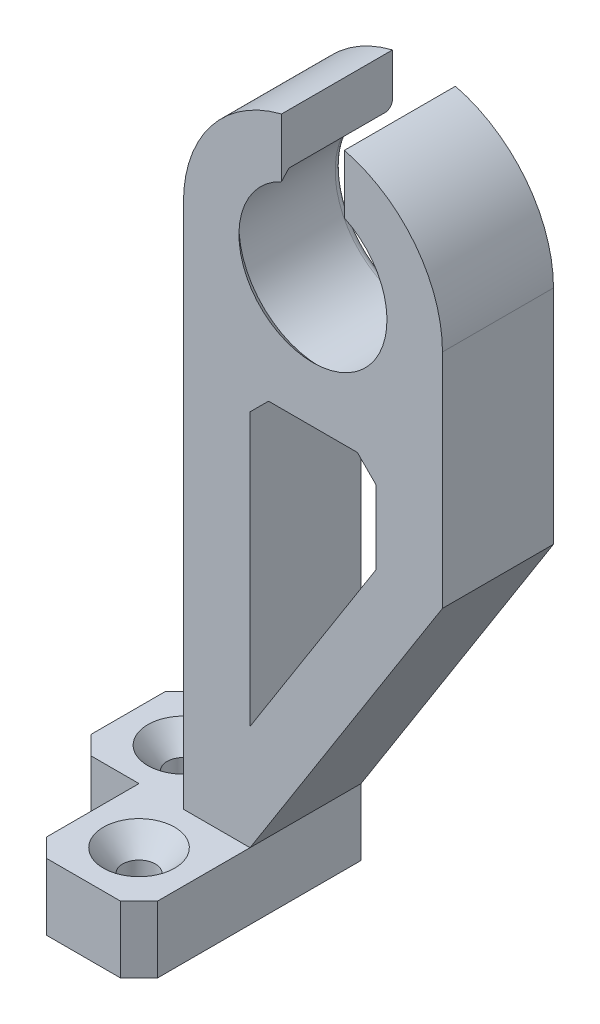
from build123d import *

# Parameters (mm, degrees)
BOSS_EXTRUDE1_DEPTH = 15
BOSS_EXTRUDE3_START = 1
BOSS_EXTRUDE3_DEPTH = 1
SKETCH7_W           = 15
SKETCH7_H           = 9
BOSS_EXTRUDE4_DEPTH = 15
FILLET1_R           = 1
CHAMFER1_SIZE       = 2.5
CHAMFER2_SIZE       = 1


with BuildPart() as part:
    # Sketch1 → Boss-Extrude1 (new body)
    with BuildSketch(Plane.XY):
        with BuildLine():
            Line((-8.5, -71), (17.5, -30))
            Line((17.5, -30), (17.5, 0))
            ThreePointArc((17.5, 0), (13.795379661, 10.767427734), (4.25, 16.976086121))
            Line((4.25, 16.976086121), (4.25, 10.145811944))
            ThreePointArc((4.25, 10.145811944), (0, -11), (-4.25, 10.145811944))
            Line((-4.25, 10.145811944), (-4.25, 16.976086121))
            ThreePointArc((-4.25, 16.976086121), (-13.795379661, 10.767427734), (-17.5, 0))
            Line((-17.5, 0), (-17.5, -71))
            Line((-17.5, -71), (-32.5, -71))
            Line((-32.5, -71), (-32.5, -80))
            Line((-32.5, -80), (-8.5, -80))
            Line((-8.5, -80), (-8.5, -71))
        make_face()
        Polygon((8.5, -17.5), (8.5, -30), (-8.5, -56.807692308), (-8.5, -17.5), align=None, mode=Mode.SUBTRACT)
    extrude(amount=BOSS_EXTRUDE1_DEPTH)

    # Sketch6 → Boss-Extrude3 (add)
    with BuildSketch(Plane(origin=(0, 0, 15), x_dir=(-1, 0, 0), z_dir=(0, 0, -1)).offset(BOSS_EXTRUDE3_START)):
        with BuildLine():
            Line((-4.25, 9.051933495), (-4.25, 10.145811944))
            ThreePointArc((-4.25, 10.145811944), (-6.093028803, -9.158329542), (11, 0))
            ThreePointArc((11, 0), (9.158329542, 6.093028803), (4.25, 10.145811944))
            Line((4.25, 10.145811944), (4.25, 9.051933495))
            ThreePointArc((4.25, 9.051933495), (8.440971508, 5.361902647), (10, 0))
            ThreePointArc((10, 0), (-5.361902647, -8.440971508), (-4.25, 9.051933495))
        make_face()
    extrude(amount=-BOSS_EXTRUDE3_DEPTH)

    # Sketch7 → Boss-Extrude4 (add)
    with BuildSketch(Plane.XY.offset(15)):
        with Locations((-16, -75.5)):
            Rectangle(SKETCH7_W, SKETCH7_H)
    extrude(amount=BOSS_EXTRUDE4_DEPTH)

    # Sketch11 → Cut-Revolve4 (revolve, cut)
    with BuildSketch(Plane.ZY.offset(25)):
        Polygon((7.5, -71), (7.5, -80), (9.7, -80), (9.7, -74), (12.307860213, -71), align=None)
    revolve(axis=Axis((-25, -71, 7.5), (0, -1, 0)), mode=Mode.SUBTRACT)

    # Sketch10 → Cut-Revolve3 (revolve, cut)
    with BuildSketch(Plane.XY.offset(22.5), mode=Mode.PRIVATE) as cut_revolve3_sk:
        Polygon((-16, -71), (-11.192139787, -71), (-13.8, -74), (-13.8, -80), (-16, -80), align=None)
    revolve(cut_revolve3_sk.sketch.rotate(Axis((-16, -80, 22.5), (0, 1, 0)), 90), axis=Axis((-16, -80, 22.5), (0, 1, 0)), mode=Mode.SUBTRACT)

    # Fillet1
    fillet1_edges = [part.edges().sort_by_distance(p)[0] for p in [
        (0, -11, 0),
    ]]
    fillet(fillet1_edges, radius=FILLET1_R)

    # Chamfer1
    chamfer1_edges = [part.edges().sort_by_distance(p)[0] for p in [
        (-32.5, -75.5, 0),
        (-8.5, -17.5, 7.5),
        (8.5, -17.5, 7.5),
        (-32.5, -75.5, 15),
        (-23.5, -75.5, 30),
        (-8.5, -75.5, 30),
    ]]
    chamfer(chamfer1_edges, length=CHAMFER1_SIZE)

    # Chamfer2
    chamfer2_edges = [part.edges().sort_by_distance(p)[0] for p in [
        (0, -10, 14),
    ]]
    chamfer(chamfer2_edges, length=CHAMFER2_SIZE - 0.0001)  # a hair under: the kernel refuses the full size


solid = part.part
